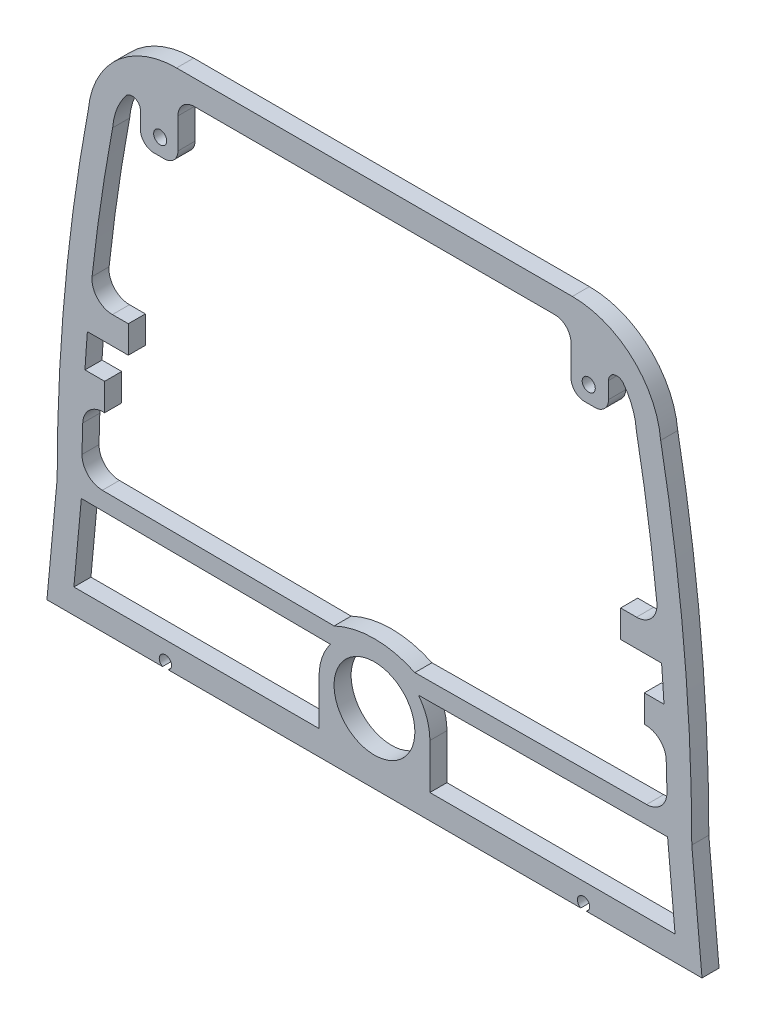
from build123d import *

# Parameters (mm, degrees)
SKETCH1_R           = 0.6096
SKETCH1_R_2         = 3.7592
BOSS_EXTRUDE1_DEPTH = 1.5875
FILLET1_R           = 1.905


with BuildPart() as part:
    # Sketch1 → Boss-Extrude1 (new body)
    with BuildSketch(Plane.XY):
        with BuildLine():
            Line((30.48, -22.225), (29.529304618, -11.9888))
            ThreePointArc((29.529304618, -11.9888), (28.804080885, 3.661869288), (26.634625221, 19.178404363))
            ThreePointArc((26.634625221, 19.178404363), (23.975715871, 24.516103507), (18.415, 26.67))
            Line((18.415, 26.67), (-18.415, 26.67))
            ThreePointArc((-18.415, 26.67), (-23.975715871, 24.516103507), (-26.634625221, 19.178404363))
            ThreePointArc((-26.634625221, 19.178404363), (-28.804080885, 3.661869288), (-29.529304618, -11.9888))
            Line((-29.529304618, -11.9888), (-30.48, -22.225))
            Line((-30.48, -22.225), (-19.719346062, -22.225))
            ThreePointArc((-19.719346062, -22.225), (-19.457528855, -21.1455), (-19.195711648, -22.225))
            Line((-19.195711648, -22.225), (19.195711648, -22.225))
            ThreePointArc((19.195711648, -22.225), (19.457528855, -21.1455), (19.719346062, -22.225))
            Line((19.719346062, -22.225), (30.48, -22.225))
        make_face()
        with BuildLine():
            Line((-16.773685627, 24.384), (16.773685627, 24.384))
            ThreePointArc((16.773685627, 24.384), (17.843769929, 23.940756569), (18.28701336, 22.870672267))
            Line((18.28701336, 22.870672267), (18.28701336, 20.039775045))
            ThreePointArc((18.28701336, 20.039775045), (18.658987748, 19.141749433), (19.55701336, 18.769775045))
            Line((19.55701336, 18.769775045), (20.512594083, 18.769775045))
            ThreePointArc((20.512594083, 18.769775045), (21.410619695, 19.141749433), (21.782594083, 20.039775045))
            Line((21.782594083, 20.039775045), (21.782594083, 21.575885307))
            ThreePointArc((21.782594083, 21.575885307), (22.302721492, 22.301099564), (23.156427057, 22.04099372))
            ThreePointArc((23.156427057, 22.04099372), (23.991734036, 20.543144377), (24.366662889, 18.869609567))
            ThreePointArc((24.366662889, 18.869609567), (25.60195696, 11.364043306), (26.494092638, 3.81))
            Line((26.494092638, 3.81), (22.905982737, 3.81))
            Line((22.905982737, 3.81), (22.905982737, 1.27))
            Line((22.905982737, 1.27), (26.715982737, 1.27))
            ThreePointArc((26.715982737, 1.27), (26.835695088, -0.329661804), (26.940031873, -1.9304))
            Line((26.940031873, -1.9304), (25.1079, -1.9304))
            Line((25.1079, -1.9304), (25.1079, -4.4704))
            Line((25.1079, -4.4704), (27.073928508, -4.4704))
            ThreePointArc((27.073928508, -4.4704), (27.186594889, -7.637676284), (27.239118354, -10.806520562))
            Line((27.239118354, -10.806520562), (3.7592, -10.9728))
            ThreePointArc((3.7592, -10.9728), (0, -10.120242576), (-3.7592, -10.9728))
            Line((-3.7592, -10.9728), (-27.239118354, -10.806520562))
            ThreePointArc((-27.239118354, -10.806520562), (-27.186594889, -7.637676284), (-27.073928508, -4.4704))
            Line((-27.073928508, -4.4704), (-25.1079, -4.4704))
            Line((-25.1079, -4.4704), (-25.1079, -1.9304))
            Line((-25.1079, -1.9304), (-26.940031873, -1.9304))
            ThreePointArc((-26.940031873, -1.9304), (-26.835695088, -0.329661804), (-26.715982737, 1.27))
            Line((-26.715982737, 1.27), (-22.905982737, 1.27))
            Line((-22.905982737, 1.27), (-22.905982737, 3.81))
            Line((-22.905982737, 3.81), (-26.494092638, 3.81))
            ThreePointArc((-26.494092638, 3.81), (-25.60195696, 11.364043306), (-24.366662889, 18.869609567))
            ThreePointArc((-24.366662889, 18.869609567), (-23.991734036, 20.543144377), (-23.156427057, 22.04099372))
            ThreePointArc((-23.156427057, 22.04099372), (-22.302721492, 22.301099564), (-21.782594083, 21.575885307))
            Line((-21.782594083, 21.575885307), (-21.782594083, 20.039775045))
            ThreePointArc((-21.782594083, 20.039775045), (-21.410619695, 19.141749433), (-20.512594083, 18.769775045))
            Line((-20.512594083, 18.769775045), (-19.55701336, 18.769775045))
            ThreePointArc((-19.55701336, 18.769775045), (-18.658987748, 19.141749433), (-18.28701336, 20.039775045))
            Line((-18.28701336, 20.039775045), (-18.28701336, 22.870672267))
            ThreePointArc((-18.28701336, 22.870672267), (-17.843769929, 23.940756569), (-16.773685627, 24.384))
        make_face(mode=Mode.SUBTRACT)
        with BuildLine():
            Line((-27.971847643, -19.939), (-27.276978113, -12.457293848))
            Line((-27.276978113, -12.457293848), (-4.100114689, -12.621427119))
            ThreePointArc((-4.100114689, -12.621427119), (-4.885049119, -14.097941352), (-5.1562, -15.748))
            Line((-5.1562, -15.748), (-5.1562, -19.939))
            Line((-5.1562, -19.939), (-27.971847643, -19.939))
        make_face(mode=Mode.SUBTRACT)
        with BuildLine():
            Line((27.971847643, -19.939), (5.1562, -19.939))
            Line((5.1562, -19.939), (5.1562, -15.748))
            ThreePointArc((5.1562, -15.748), (4.885049119, -14.097941352), (4.100114689, -12.621427119))
            Line((4.100114689, -12.621427119), (27.276978113, -12.457293848))
            Line((27.276978113, -12.457293848), (27.971847643, -19.939))
        make_face(mode=Mode.SUBTRACT)
        with Locations((19.939, 20.32)):
            Circle(SKETCH1_R, mode=Mode.SUBTRACT)
        with Locations((-19.939, 20.32)):
            Circle(SKETCH1_R, mode=Mode.SUBTRACT)
        with Locations((0, -15.748)):
            Circle(SKETCH1_R_2, mode=Mode.SUBTRACT)
    extrude(amount=BOSS_EXTRUDE1_DEPTH)

    # Fillet1
    fillet1_edges = [part.edges().sort_by_distance(p)[0] for p in [
        (26.494092638, 3.81, 0.79375),
        (-27.239118354, -10.806520562, 0.79375),
        (-27.073928508, -4.4704, 0.79375),
        (-26.494092638, 3.81, 0.79375),
        (27.239118354, -10.806520562, 0.79375),
        (27.073928508, -4.4704, 0.79375),
    ]]
    fillet(fillet1_edges, radius=FILLET1_R)


solid = part.part
